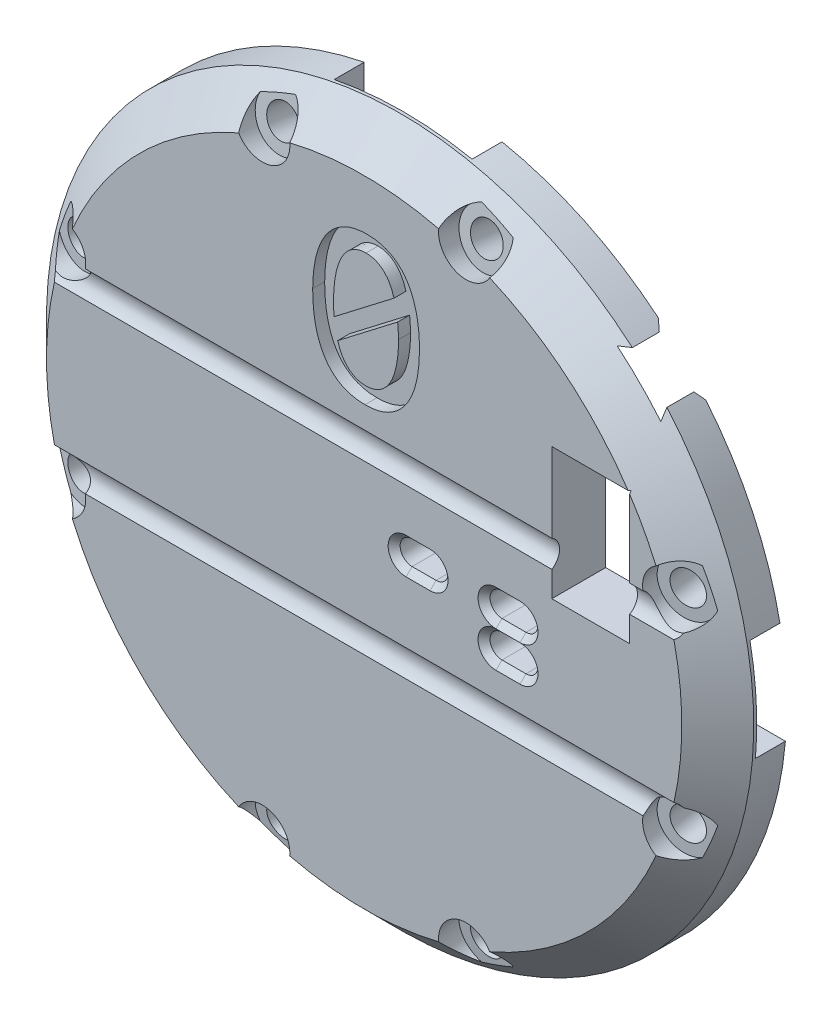
from build123d import *

# Parameters (mm, degrees)
SKETCH1_R               = 29.5
BOSS_EXTRUDE1_DEPTH     = 5.75
SKETCH3_W               = 44.5
SKETCH3_H               = 44.5
CUT_EXTRUDE1_DEPTH      = 3.25
BOSS_EXTRUDE5_DEPTH     = 3.25
CHAMFER2_SIZE           = 3
CUT_EXTRUDE5_DEPTH      = 43.113685424
CUT_EXTRUDE5_DEPTH_BACK = 43.113685424
SKETCH9_R               = 1.3
SKETCH10_W              = 12.03351403
SKETCH10_H              = 11.5
SKETCH10_W_2            = 11.5
SKETCH10_H_2            = 12.03351403
CUT_EXTRUDE6_DEPTH      = 2.5
SKETCH13_W              = 6.5
SKETCH13_H              = 11
CUT_EXTRUDE9_DEPTH      = 42.845698845
SKETCH14_W              = 15.887507813
SKETCH14_H              = 11.6
CUT_EXTRUDE10_DEPTH     = 2.5
BOSS_EXTRUDE3_START     = 2.5
BOSS_EXTRUDE3_DEPTH     = 2.5
SKETCH17_R              = 1.35
CUT_EXTRUDE12_DEPTH     = 43.113685578
CUT_EXTRUDE13_START     = 20
SKETCH18_R              = 2.3
CUT_EXTRUDE13_DEPTH     = 12.5
CIRPATTERN1_COUNT       = 4
CUT_EXTRUDE14_DEPTH     = 43.113685564
BOSS_EXTRUDE2_DEPTH     = 2
FILLET1_R               = 1
CUT_EXTRUDE16_DEPTH     = 1
BOSS_EXTRUDE4_DEPTH     = 2
CHAMFER3_SIZE           = 0.5
CHAMFER4_SIZE           = 0.5
CHAMFER5_SIZE           = 0.5


# Some blends are built 0.0001 mm under size
with BuildPart() as part:
    # Sketch1 → Boss-Extrude1 (new body)
    with BuildSketch(Plane.XY):
        Circle(SKETCH1_R)
    extrude(amount=BOSS_EXTRUDE1_DEPTH)

    # Sketch3 → Cut-Extrude1 (cut)
    with BuildSketch(Plane(origin=(0, 0, 0), x_dir=(-1, 0, 0), z_dir=(0, 0, -1))):
        Rectangle(SKETCH3_W, SKETCH3_H)
    extrude(amount=-CUT_EXTRUDE1_DEPTH, mode=Mode.SUBTRACT)

    # Sketch26 → Boss-Extrude5 (add)
    with BuildSketch(Plane(origin=(0, 0, 0), x_dir=(-1, 0, 0), z_dir=(0, 0, -1))):
        with BuildLine():
            Line((22.25, 19.369757355), (22.25, 17.809758561))
            ThreePointArc((22.25, 17.809758561), (20.152543264, 20.152543264), (17.809758561, 22.25))
            Line((17.809758561, 22.25), (19.369757355, 22.25))
            ThreePointArc((19.369757355, 22.25), (20.859650045, 20.859650045), (22.25, 19.369757355))
        make_face()
        with BuildLine():
            Line((19.369757355, -22.25), (17.809758561, -22.25))
            ThreePointArc((17.809758561, -22.25), (20.152543264, -20.152543264), (22.25, -17.809758561))
            Line((22.25, -17.809758561), (22.25, -19.369757355))
            ThreePointArc((22.25, -19.369757355), (20.859650045, -20.859650045), (19.369757355, -22.25))
        make_face()
        with BuildLine():
            Line((-22.25, -19.369757355), (-22.25, -17.809758561))
            ThreePointArc((-22.25, -17.809758561), (-20.152543264, -20.152543264), (-17.809758561, -22.25))
            Line((-17.809758561, -22.25), (-19.369757355, -22.25))
            ThreePointArc((-19.369757355, -22.25), (-20.859650045, -20.859650045), (-22.25, -19.369757355))
        make_face()
    extrude(amount=-BOSS_EXTRUDE5_DEPTH)

    # Chamfer2
    # the kernel refuses this chamfer: 3 mm, written as the material it takes off along each edge
    with BuildSketch(Plane(origin=(0, 0, 5.75), x_dir=(1, 0, 0), z_dir=(0, -1, 0))) as chamfer2_piece_1:
        Polygon((29.5, -CHAMFER2_SIZE), (29.5 - CHAMFER2_SIZE, 0), (29.5, 0), align=None)
    revolve(axis=Axis((0, 0, 5.75), (0, 0, 1)), mode=Mode.SUBTRACT)

    # Sketch9 → Cut-Extrude5 (cut, two sides: drawn at the far end of the back side and taken through both)
    with BuildSketch(Plane(origin=(0, 0, 0), x_dir=(0, 0, -1), z_dir=(1, 0, 0)).offset(-CUT_EXTRUDE5_DEPTH_BACK)):
        with Locations((-6.4, 7)):
            Circle(SKETCH9_R)
        with Locations((-6.4, -7)):
            Circle(SKETCH9_R)
    extrude(amount=CUT_EXTRUDE5_DEPTH + CUT_EXTRUDE5_DEPTH_BACK, mode=Mode.SUBTRACT)

    # Sketch10 → Cut-Extrude6 (cut)
    with BuildSketch(Plane(origin=(0, 0, 0), x_dir=(-1, 0, 0), z_dir=(0, 0, -1))):
        with Locations((28.01742408, 0)):
            Rectangle(SKETCH10_W, SKETCH10_H)
        with Locations((-28.01742408, 0)):
            Rectangle(SKETCH10_W, SKETCH10_H)
        with Locations((0, 28.01742408)):
            Rectangle(SKETCH10_W_2, SKETCH10_H_2)
    extrude(amount=-CUT_EXTRUDE6_DEPTH, mode=Mode.SUBTRACT)

    # Sketch13 → Cut-Extrude9 (cut, through all)
    with BuildSketch(Plane(origin=(0, 0, 3.25), x_dir=(-1, 0, 0), z_dir=(0, 0, -1))):
        with Locations((-18.9, 9.25)):
            Rectangle(SKETCH13_W, SKETCH13_H)
    extrude(amount=-CUT_EXTRUDE9_DEPTH, mode=Mode.SUBTRACT)

    # Sketch14 → Cut-Extrude10 (cut)
    with BuildSketch(Plane(origin=(0, 0, 0), x_dir=(-1, 0, 0), z_dir=(0, 0, -1))):
        with Locations((-27.176000206, -5.8)):
            Rectangle(SKETCH14_W, SKETCH14_H)
    extrude(amount=-CUT_EXTRUDE10_DEPTH, mode=Mode.SUBTRACT)

    # Sketch23 → Boss-Extrude3 (add)
    with BuildSketch(Plane(origin=(0, 0, 2.5), x_dir=(-1, 0, 0), z_dir=(0, 0, -1)).offset(BOSS_EXTRUDE3_START)):
        with BuildLine():
            Line((-22.25, -2.55), (-29.389581487, -2.55))
            ThreePointArc((-29.389581487, -2.55), (-28.616616042, -7.165143842), (-27.123605955, -11.6))
            Line((-27.123605955, -11.6), (-22.25, -11.6))
            Line((-22.25, -11.6), (-22.25, -2.55))
        make_face()
    extrude(amount=-BOSS_EXTRUDE3_DEPTH)

    # Sketch17 → Cut-Extrude12 (cut, through all)
    with BuildSketch(Plane(origin=(0, 0, 0), x_dir=(0, -1, 0), z_dir=(0.13917310096006574, 0, 0.9902680687415703))):
        with Locations(Location((-8.5, 24.5, 0), (0, 0, 270))):
            Circle(SKETCH17_R)
        with Locations(Location((8.5, 24.5, 0), (0, 0, 270))):
            Circle(SKETCH17_R)
    cut_extrude12 = extrude(amount=CUT_EXTRUDE12_DEPTH, mode=Mode.SUBTRACT)

    # Sketch18 → Cut-Extrude13 (cut)
    with BuildSketch(Plane(origin=(0, 0, 0), x_dir=(0, -1, 0), z_dir=(0.13917310096006574, 0, 0.9902680687415703)).offset(CUT_EXTRUDE13_START)):
        with Locations((-8.5, 24.5)):
            Circle(SKETCH18_R)
        with Locations((8.5, 24.5)):
            Circle(SKETCH18_R)
    cut_extrude13 = extrude(amount=-CUT_EXTRUDE13_DEPTH, mode=Mode.SUBTRACT)

    # CirPattern1: Cut-Extrude12, Cut-Extrude13 ×4 about axis
    cirpattern1_axis = Axis((0, 0, 0), (0, 0, 1))
    add([cut_extrude12.rotate(cirpattern1_axis, i * 360 / CIRPATTERN1_COUNT) for i in range(1, CIRPATTERN1_COUNT)], mode=Mode.SUBTRACT)
    add([cut_extrude13.rotate(cirpattern1_axis, i * 360 / CIRPATTERN1_COUNT) for i in range(1, CIRPATTERN1_COUNT)], mode=Mode.SUBTRACT)

    # Sketch19 → Cut-Extrude14 (cut, through all)
    with BuildSketch(Plane.XY.offset(5.75)):
        with BuildLine():
            Line((3.5, 1.75), (5.5, 1.75))
            ThreePointArc((5.5, 1.75), (6.5, 0.75), (5.5, -0.25))
            Line((5.5, -0.25), (3.5, -0.25))
            ThreePointArc((3.5, -0.25), (2.5, 0.75), (3.5, 1.75))
        make_face()
        with BuildLine():
            Line((11, 1.75), (13, 1.75))
            ThreePointArc((13, 1.75), (14, 0.75), (13, -0.25))
            Line((13, -0.25), (11, -0.25))
            ThreePointArc((11, -0.25), (10, 0.75), (11, 1.75))
        make_face()
        with BuildLine():
            Line((11, -1.25), (13, -1.25))
            ThreePointArc((13, -1.25), (14, -2.25), (13, -3.25))
            Line((13, -3.25), (11, -3.25))
            ThreePointArc((11, -3.25), (10, -2.25), (11, -1.25))
        make_face()
    extrude(amount=-CUT_EXTRUDE14_DEPTH, mode=Mode.SUBTRACT)

    # Sketch21 → Boss-Extrude2 (add)
    # profile 1 of 2: a face of its own
    with BuildSketch(Plane(origin=(0, 0, 3.25), x_dir=(-1, 0, 0), z_dir=(0, 0, -1))):
        with BuildLine():
            Line((-5.5, -1.35), (-3.5, -1.35))
            ThreePointArc((-3.5, -1.35), (-1.4, 0.75), (-3.5, 2.85))
            Line((-3.5, 2.85), (-5.5, 2.85))
            ThreePointArc((-5.5, 2.85), (-7.6, 0.75), (-5.5, -1.35))
        make_face()
        with BuildLine():
            Line((-5.5, -0.35), (-3.5, -0.35))
            ThreePointArc((-3.5, -0.35), (-2.4, 0.75), (-3.5, 1.85))
            Line((-3.5, 1.85), (-5.5, 1.85))
            ThreePointArc((-5.5, 1.85), (-6.6, 0.75), (-5.5, -0.35))
        make_face(mode=Mode.SUBTRACT)
    # profile 2 of 2: a face of its own
    with BuildSketch(Plane(origin=(0, 0, 3.25), x_dir=(-1, 0, 0), z_dir=(0, 0, -1))):
        with BuildLine():
            Line((-11, 2.85), (-13, 2.85))
            ThreePointArc((-13, 2.85), (-14.94422221, 1.543725393), (-14.469693846, -0.75))
            ThreePointArc((-14.469693846, -0.75), (-14.94422221, -3.043725393), (-13, -4.35))
            Line((-13, -4.35), (-11, -4.35))
            ThreePointArc((-11, -4.35), (-9.05577779, -3.043725393), (-9.530306154, -0.75))
            ThreePointArc((-9.530306154, -0.75), (-9.05577779, 1.543725393), (-11, 2.85))
        make_face()
        with BuildLine():
            Line((-11, 1.85), (-13, 1.85))
            ThreePointArc((-13, 1.85), (-14.1, 0.75), (-13, -0.35))
            Line((-13, -0.35), (-11, -0.35))
            ThreePointArc((-11, -0.35), (-9.9, 0.75), (-11, 1.85))
        make_face(mode=Mode.SUBTRACT)
        with BuildLine():
            Line((-11, -1.15), (-13, -1.15))
            ThreePointArc((-13, -1.15), (-14.1, -2.25), (-13, -3.35))
            Line((-13, -3.35), (-11, -3.35))
            ThreePointArc((-11, -3.35), (-9.9, -2.25), (-11, -1.15))
        make_face(mode=Mode.SUBTRACT)
    extrude(amount=BOSS_EXTRUDE2_DEPTH)

    # Fillet1
    fillet1_edges = [part.edges().sort_by_distance(p)[0] for p in [
        (7.6, 0.75, 3.25),
        (4.5, -1.35, 3.25),
        (1.4, 0.75, 3.25),
        (4.5, 2.85, 3.25),
        (14.94422221, -3.043725393, 3.25),
        (12, -4.35, 3.25),
        (9.05577779, -3.043725393, 3.25),
    ]]
    fillet(fillet1_edges, radius=FILLET1_R)

    # Sketch24 → Cut-Extrude16 (cut)
    with BuildSketch(Plane.XY.offset(5.75)):
        with BuildLine():
            add(Edge.make_bspline(
                [(4.61211941, 16.170450521), (4.609629847, 15.944710661), (4.604753386, 15.502540156), (4.5474431, 14.855747051), (4.461834353, 14.238402943), (4.339569969, 13.652833419), (4.184435004, 13.101054198), (3.985267501, 12.58976335), (3.755527346, 12.116733529), (3.48713078, 11.685448982), (3.183653033, 11.298830964), (2.844863255, 10.956051233), (2.470202852, 10.660423402), (2.059568041, 10.412999717), (1.614490849, 10.213057971), (1.129845793, 10.076559514), (0.609812084, 9.988743691), (0.25038528, 9.979838517), (0.065336217, 9.975253733)],
                knots=[0, 0, 0, 0, 1.248871528, 2.446241243, 3.590357027, 4.69618527, 5.754202854, 6.758290001, 7.728669934, 8.660396172, 9.563796911, 10.443071522, 11.321307858, 12.197637495, 13.090115231, 14.012601613, 14.976798049, 16, 16, 16, 16], degree=3))
            add(Edge.make_bspline(
                [(0.065336217, 9.975253733), (-0.095009986, 9.979157064), (-0.410839977, 9.986845358), (-0.873176697, 10.056194869), (-1.312758847, 10.171936701), (-1.730384642, 10.328642103), (-2.12104236, 10.538148865), (-2.482674643, 10.796422121), (-2.816831896, 11.102205137), (-3.117803226, 11.460864468), (-3.388575826, 11.86875509), (-3.623464032, 12.33033077), (-3.826539278, 12.841315562), (-3.999911714, 13.403819828), (-4.130762705, 14.020606741), (-4.229063227, 14.689502725), (-4.285631541, 15.41258653), (-4.292374342, 15.911990637), (-4.295863988, 16.170450521)],
                knots=[0, 0, 0, 0, 0.897102697, 1.767001224, 2.609309556, 3.43771295, 4.257811968, 5.082953918, 5.919052252, 6.786174452, 7.6970727, 8.653553743, 9.679470751, 10.771494031, 11.944028827, 13.204944144, 14.553456404, 16, 16, 16, 16], degree=3))
            add(Edge.make_bspline(
                [(-4.295863988, 16.170450521), (-4.291796106, 16.396146108), (-4.283813508, 16.83903925), (-4.233047824, 17.488264024), (-4.14258563, 18.107103849), (-4.018386797, 18.693789118), (-3.858208569, 19.246227744), (-3.662549083, 19.759570194), (-3.433020668, 20.23275539), (-3.167598633, 20.66461996), (-2.865470038, 21.052747666), (-2.525748193, 21.395613482), (-2.150834305, 21.6922239), (-1.737706369, 21.938770374), (-1.290753387, 22.138279627), (-0.806278818, 22.274977128), (-0.289021583, 22.362965532), (0.067688601, 22.371949287), (0.250919205, 22.376563954)],
                knots=[0, 0, 0, 0, 1.248165713, 2.449334701, 3.598380242, 4.704508407, 5.763215836, 6.776019403, 7.739017366, 8.667464557, 9.574217704, 10.452902578, 11.330549874, 12.210601904, 13.107080692, 14.028948355, 14.987533857, 16, 16, 16, 16], degree=3))
            add(Edge.make_bspline(
                [(0.250919205, 22.376563954), (0.411269181, 22.372660629), (0.727106604, 22.364972345), (1.188517072, 22.295753627), (1.627789233, 22.18029158), (2.043744989, 22.018946136), (2.436535735, 21.812746675), (2.797205806, 21.551596472), (3.130472077, 21.244113249), (3.430647106, 20.883070242), (3.702412373, 20.47370193), (3.939457778, 20.01310548), (4.140595821, 19.50024029), (4.311854836, 18.93834067), (4.448443999, 18.322627028), (4.544926285, 17.654041974), (4.602069238, 16.930160011), (4.608688101, 16.429828958), (4.61211941, 16.170450521)],
                knots=[0, 0, 0, 0, 0.896490568, 1.765795528, 2.602608418, 3.432274242, 4.256303472, 5.076742829, 5.915718828, 6.786140009, 7.696416714, 8.659101079, 9.677705081, 10.773848187, 11.941709476, 13.20176442, 14.549356535, 16, 16, 16, 16], degree=3))
        make_face()
        with BuildLine():
            add(Edge.make_bspline(
                [(2.865455999, 16.077659027), (2.864839005, 16.182323934), (2.863609324, 16.390923317), (2.840362021, 16.701771488), (2.82092987, 17.008594617), (2.801406756, 17.211212302), (2.791768636, 17.311240061)],
                knots=[0, 0, 0, 0, 1.015676625, 2.024265076, 3.024624451, 4, 4, 4, 4], degree=3))
            Line((2.791768636, 17.311240061), (-2.208055379, 13.468580556))
            add(Edge.make_bspline(
                [(-2.208055379, 13.468580556), (-2.15883924, 13.321137051), (-2.062306301, 13.031940146), (-1.876021988, 12.624239729), (-1.647689417, 12.260106137), (-1.373202208, 11.950099151), (-1.054058419, 11.70114286), (-0.756867451, 11.542285481), (-0.497626757, 11.456417233), (-0.289850061, 11.405797387), (-0.068113772, 11.380151789), (0.083478776, 11.375141757), (0.160856873, 11.372584462)],
                knots=[0, 0, 0, 0, 1.361870802, 2.671184605, 3.91877896, 5.116024374, 6.280451232, 7.450298556, 8.047911377, 8.670688444, 9.321473259, 10, 10, 10, 10], degree=3))
            add(Edge.make_bspline(
                [(0.160856873, 11.372584462), (0.261236207, 11.37605025), (0.459132471, 11.382882995), (0.747845416, 11.443326699), (1.023392987, 11.534783817), (1.282500154, 11.668912059), (1.526984601, 11.837213529), (1.747490888, 12.049106291), (1.955116864, 12.290390253), (2.139647736, 12.571150526), (2.305971243, 12.886730108), (2.453949566, 13.237943691), (2.577781922, 13.625580337), (2.680802736, 14.048969947), (2.765584334, 14.506147776), (2.824395418, 14.999278733), (2.860316703, 15.526735082), (2.863707249, 15.890195913), (2.865455999, 16.077659027)],
                knots=[0, 0, 0, 0, 0.796240393, 1.569775284, 2.332781704, 3.095240773, 3.878796528, 4.681173991, 5.516437293, 6.40201063, 7.34239963, 8.345981007, 9.424260963, 10.57011489, 11.804224653, 13.114209461, 14.5115885, 16, 16, 16, 16], degree=3))
        make_face(mode=Mode.SUBTRACT)
        with BuildLine():
            add(Edge.make_bspline(
                [(-2.549200577, 16.189554652), (-2.549314077, 16.092214042), (-2.549541082, 15.897528572), (-2.547848715, 15.607261836), (-2.538220317, 15.321297037), (-2.521814903, 15.133315979), (-2.513721476, 15.040577626)],
                knots=[0, 0, 0, 0, 1.015676347, 2.03139705, 3.028811753, 4, 4, 4, 4], degree=3))
            Line((-2.513721476, 15.040577626), (2.488831701, 18.883237131))
            add(Edge.make_bspline(
                [(2.488831701, 18.883237131), (2.441519721, 19.032928382), (2.34951335, 19.324029042), (2.154657958, 19.726475414), (1.932110388, 20.089680276), (1.657641813, 20.394726329), (1.347016239, 20.649855815), (1.050175177, 20.804573168), (0.796234371, 20.895771925), (0.592448081, 20.945854153), (0.377120221, 20.971599281), (0.230053591, 20.976662829), (0.15539855, 20.979233225)],
                knots=[0, 0, 0, 0, 1.387569518, 2.698370158, 3.946895934, 5.144331536, 6.312393877, 7.486406228, 8.084826247, 8.697958228, 9.339048001, 10, 10, 10, 10], degree=3))
            add(Edge.make_bspline(
                [(0.15539855, 20.979233225), (0.055054687, 20.975663768), (-0.142771643, 20.968626641), (-0.431442528, 20.909788248), (-0.705746907, 20.812659892), (-0.965915663, 20.678305819), (-1.210843072, 20.5062074), (-1.431927482, 20.290626753), (-1.642642062, 20.045358222), (-1.825741263, 19.755612591), (-1.992375785, 19.433461386), (-2.137705442, 19.074210804), (-2.260647813, 18.679364009), (-2.368655055, 18.249806697), (-2.448304665, 17.784320395), (-2.508444977, 17.284351538), (-2.543962845, 16.748640248), (-2.547418846, 16.379740037), (-2.549200577, 16.189554652)],
                knots=[0, 0, 0, 0, 0.786453526, 1.550480632, 2.299704824, 3.062398082, 3.840423392, 4.637837687, 5.478332318, 6.370910143, 7.318703432, 8.320397478, 9.40580758, 10.560070273, 11.791787257, 13.106920475, 14.508481623, 16, 16, 16, 16], degree=3))
        make_face(mode=Mode.SUBTRACT)
    extrude(amount=-CUT_EXTRUDE16_DEPTH, mode=Mode.SUBTRACT)

    # Sketch25 → Boss-Extrude4 (add)
    with BuildSketch(Plane(origin=(0, 0, 3.25), x_dir=(-1, 0, 0), z_dir=(0, 0, -1))):
        Polygon((-22.25, 15.75), (-22.25, 14.75), (-15.65, 14.75), (-15.65, 3.75), (-22.25, 3.75), (-22.25, 2.75), (-14.65, 2.75), (-14.65, 15.75), align=None)
    extrude(amount=BOSS_EXTRUDE4_DEPTH)

    # Chamfer3
    chamfer3_edges = [part.edges().sort_by_distance(p)[0] for p in [
        (18.45, 15.75, 1.25),
        (18.45, 2.75, 1.25),
        (14.65, 9.25, 1.25),
    ]]
    chamfer(chamfer3_edges, length=CHAMFER3_SIZE)

    # Chamfer4
    chamfer4_edges = [part.edges().sort_by_distance(p)[0] for p in [
        (2.5, 0.75, 5.75),
        (4.5, -0.25, 5.75),
        (6.5, 0.75, 5.75),
        (4.5, 1.75, 5.75),
        (10, 0.75, 5.75),
        (12, -0.25, 5.75),
        (14, 0.75, 5.75),
        (12, 1.75, 5.75),
        (10, -2.25, 5.75),
        (12, -3.25, 5.75),
        (14, -2.25, 5.75),
        (12, -1.25, 5.75),
    ]]
    chamfer(chamfer4_edges, length=CHAMFER4_SIZE - 0.0001)  # a hair under: the kernel refuses the full size

    # Chamfer5
    chamfer5_edges = [part.edges().sort_by_distance(p)[0] for p in [
        (-11.77987928, 22.25, 0),
        (22.25, 12.559878678, 0),
        (-22.25, -11.77987928, 0),
        (22.25, -10.17987928, 0),
        (-22.25, 11.77987928, 0),
        (0, -22.25, 0),
        (12.559878678, 22.25, 0),
    ]]
    chamfer(chamfer5_edges, length=CHAMFER5_SIZE)


solid = part.part
